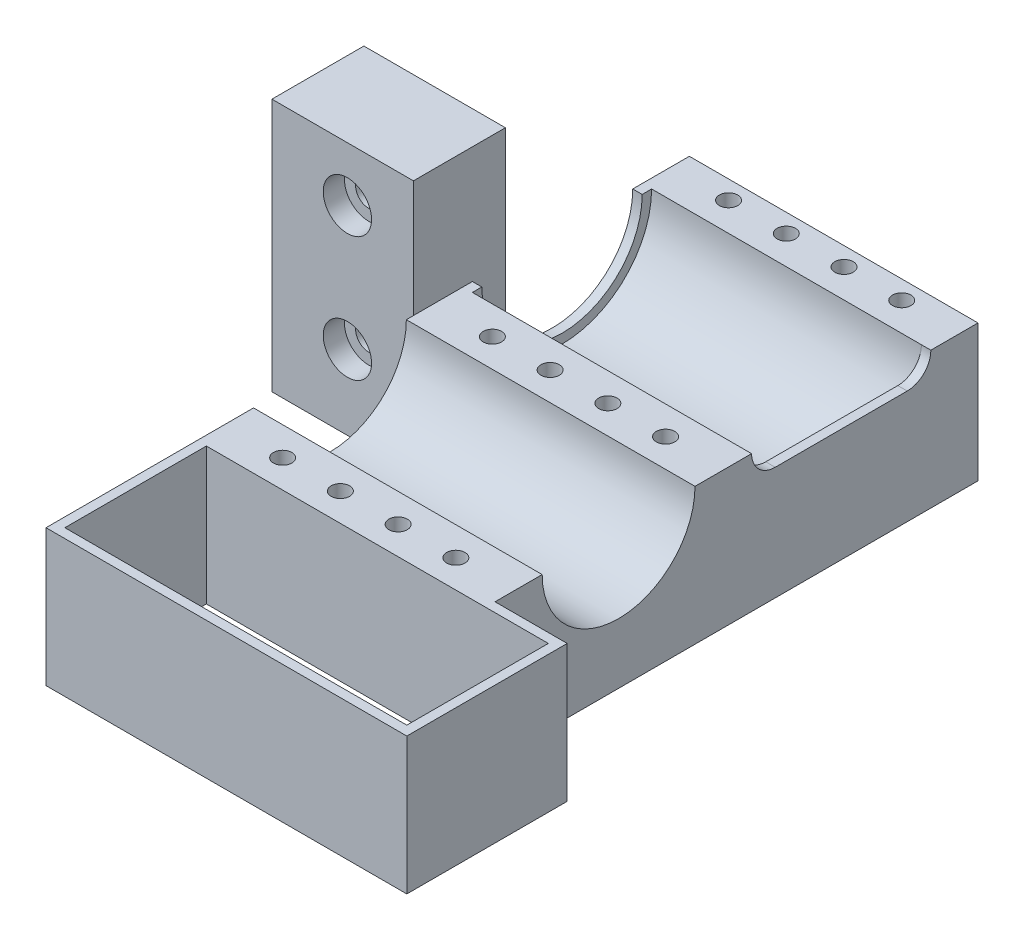
from build123d import *

# Parameters (mm, degrees)
BOSS_EXTRUDE1_DEPTH = 61.2
SKETCH7_W           = 19.50078266
SKETCH7_H           = 53.740928499
BOSS_EXTRUDE2_DEPTH = 30
BOSS_EXTRUDE3_START = -2
BOSS_EXTRUDE3_DEPTH = 2
BOSS_EXTRUDE4_DEPTH = 2
SKETCH26_W          = 76.5
SKETCH26_H          = 34
SKETCH26_W_2        = 72.5
SKETCH26_H_2        = 30
BOSS_EXTRUDE5_DEPTH = 29
SKETCH8_R           = 2.75
CUT_EXTRUDE1_DEPTH  = 19.50078266
SKETCH9_R           = 5.125
CUT_EXTRUDE2_DEPTH  = 4.5
CUT_EXTRUDE8_START  = -4.5
SKETCH10_R          = 5.125
CUT_EXTRUDE8_DEPTH  = 4.5
SKETCH22_R          = 1.95
CUT_EXTRUDE9_DEPTH  = 29
CUT_EXTRUDE10_DEPTH = 4.5
CUT_EXTRUE11_DEPTH  = 2


# Read off the part's stored shape, not the designer's step: Split1
with BuildPart() as part:
    # Sketch1 → Boss-Extrude1 (new body)
    with BuildSketch(Plane(origin=(0, 0, 0), x_dir=(0, 0, -1), z_dir=(1, 0, 0))):
        with BuildLine():
            Line((0, 0), (102.4, 0))
            Line((102.4, 0), (102.4, 29))
            Line((102.4, 29), (92.4, 29))
            ThreePointArc((92.4, 29), (73.4, 10), (54.4, 29))
            Line((54.4, 29), (42.4, 29))
            ThreePointArc((42.4, 29), (26.2, 12.8), (10, 29))
            Line((10, 29), (0, 29))
            Line((0, 29), (0, 0))
        make_face()
    extrude(amount=BOSS_EXTRUDE1_DEPTH)

    # Sketch7 → Boss-Extrude2 (add)
    with BuildSketch(Plane.ZY):
        with Locations((-53.64960867, 26.87046425)):
            Rectangle(SKETCH7_W, SKETCH7_H)
    extrude(amount=BOSS_EXTRUDE2_DEPTH)

    # Sketch14 → Boss-Extrude3 (add)
    with BuildSketch(Plane(origin=(61.2, 0, 0), x_dir=(0, 0, -1), z_dir=(1, 0, 0)).offset(BOSS_EXTRUDE3_START)):
        with BuildLine():
            Line((54.4, 29), (92.4, 29))
            ThreePointArc((92.4, 29), (73.4, 10), (54.4, 29))
        make_face()
    extrude(amount=BOSS_EXTRUDE3_DEPTH)

    # Sketch19 → Boss-Extrude4 (add)
    with BuildSketch(Plane.ZY):
        with BuildLine():
            Line((-90.4, 29), (-92.4, 29))
            ThreePointArc((-92.4, 29), (-82.646621004, 12.401807327), (-63.4, 12.844505579))
            ThreePointArc((-63.4, 12.844505579), (-56.801807327, 19.753378996), (-54.4, 29))
            Line((-54.4, 29), (-56.4, 29))
            ThreePointArc((-56.4, 29), (-58.548985503, 20.726707522), (-64.452631579, 14.545083939))
            ThreePointArc((-64.452631579, 14.545083939), (-81.673292478, 14.148985503), (-90.4, 29))
        make_face()
    extrude(amount=-BOSS_EXTRUDE4_DEPTH)

    # Sketch26 → Boss-Extrude5 (add)
    with BuildSketch(Plane(origin=(0, 0, 0), x_dir=(1, 0, 0), z_dir=(0, 1, 0))):
        with Locations((38.25, -17)):
            Rectangle(SKETCH26_W, SKETCH26_H)
        with Locations((38.25, -17)):
            Rectangle(SKETCH26_W_2, SKETCH26_H_2, mode=Mode.SUBTRACT)
    extrude(amount=BOSS_EXTRUDE5_DEPTH)

    # Sketch8 → Cut-Extrude1 (cut)
    with BuildSketch(Plane(origin=(0, 0, -63.4), x_dir=(-1, 0, 0), z_dir=(0, 0, -1))):
        with Locations((14, 42.2)):
            Circle(SKETCH8_R)
        with Locations((14, 15.8)):
            Circle(SKETCH8_R)
    extrude(amount=-CUT_EXTRUDE1_DEPTH, mode=Mode.SUBTRACT)

    # Sketch9 → Cut-Extrude2 (cut)
    with BuildSketch(Plane(origin=(0, 0, -63.4), x_dir=(-1, 0, 0), z_dir=(0, 0, -1))):
        with Locations((14, 42.2)):
            Circle(SKETCH9_R)
        with Locations((14, 15.8)):
            Circle(SKETCH9_R)
    extrude(amount=-CUT_EXTRUDE2_DEPTH, mode=Mode.SUBTRACT)

    # Sketch10 → Cut-Extrude8 (cut)
    with BuildSketch(Plane.XY.offset(-43.89921734).offset(CUT_EXTRUDE8_START)):
        with Locations(Location((-14, 42.2, 0), (0, 0, 180))):
            Circle(SKETCH10_R)
        with Locations(Location((-14, 15.8, 0), (0, 0, 180))):
            Circle(SKETCH10_R)
    extrude(amount=CUT_EXTRUDE8_DEPTH, mode=Mode.SUBTRACT)

    # Sketch22 → Cut-Extrude9 (cut)
    with BuildSketch(Plane(origin=(0, 29, 0), x_dir=(1, 0, 0), z_dir=(0, 1, 0))):
        with Locations(Location((12.24, 48.4, 0), (0, 0, 270))):
            Circle(SKETCH22_R)
        with Locations(Location((24.48, 48.4, 0), (0, 0, 270))):
            Circle(SKETCH22_R)
        with Locations(Location((36.72, 48.4, 0), (0, 0, 270))):
            Circle(SKETCH22_R)
        with Locations(Location((48.96, 48.4, 0), (0, 0, 270))):
            Circle(SKETCH22_R)
        with Locations(Location((48.96, 98.47, 0), (0, 0, 270))):
            Circle(SKETCH22_R)
        with Locations(Location((24.48, 98.47, 0), (0, 0, 270))):
            Circle(SKETCH22_R)
        with Locations(Location((12.24, 98.47, 0), (0, 0, 270))):
            Circle(SKETCH22_R)
        with Locations(Location((36.72, 3.93, 0), (0, 0, 270))):
            Circle(SKETCH22_R)
        with Locations(Location((48.96, 3.93, 0), (0, 0, 270))):
            Circle(SKETCH22_R)
        with Locations(Location((12.24, 3.93, 0), (0, 0, 270))):
            Circle(SKETCH22_R)
        with Locations(Location((36.72, 98.47, 0), (0, 0, 270))):
            Circle(SKETCH22_R)
        with Locations(Location((24.48, 3.93, 0), (0, 0, 270))):
            Circle(SKETCH22_R)
    extrude(amount=-CUT_EXTRUDE9_DEPTH, mode=Mode.SUBTRACT)

    # Sketch24 → Cut-Extrude10 (cut)
    with BuildSketch(Plane.XZ):
        Polygon((15.704101615, -3.93), (13.972050808, -0.93), (10.507949192, -0.93), (8.775898385, -3.93), (10.507949192, -6.93), (13.972050808, -6.93), align=None)
        Polygon((27.944101615, -3.93), (26.212050808, -0.93), (22.747949192, -0.93), (21.015898385, -3.93), (22.747949192, -6.93), (26.212050808, -6.93), align=None)
        Polygon((40.184101615, -3.93), (38.452050808, -0.93), (34.987949192, -0.93), (33.255898385, -3.93), (34.987949192, -6.93), (38.452050808, -6.93), align=None)
        Polygon((52.424101615, -3.93), (50.692050808, -0.93), (47.227949192, -0.93), (45.495898385, -3.93), (47.227949192, -6.93), (50.692050808, -6.93), align=None)
        Polygon((45.495898507, -48.400921437), (47.228747241, -51.400460612), (50.692848734, -51.399539176), (52.424101493, -48.399078563), (50.691252759, -45.399539388), (47.227151266, -45.400460824), align=None)
        Polygon((33.255898447, -48.400654162), (34.988515744, -51.400327028), (38.452617298, -51.399672865), (40.184101553, -48.399345838), (38.451484256, -45.399672972), (34.987382702, -45.400327135), align=None)
        Polygon((21.015898427, -48.400539686), (22.748416595, -51.400269807), (26.212518168, -51.399730121), (27.944101573, -48.399460314), (26.211583405, -45.399730193), (22.747481832, -45.400269879), align=None)
        Polygon((8.775898415, -48.400459038), (10.508346746, -51.400229493), (13.972448331, -51.399770455), (15.704101585, -48.399540962), (13.971653254, -45.399770507), (10.507551669, -45.400229545), align=None)
        Polygon((10.507949192, -95.47), (8.775898385, -98.47), (10.507949192, -101.47), (13.972050808, -101.47), (15.704101615, -98.47), (13.972050808, -95.47), align=None)
        Polygon((22.747949192, -95.47), (21.015898385, -98.47), (22.747949192, -101.47), (26.212050808, -101.47), (27.944101615, -98.47), (26.212050808, -95.47), align=None)
        Polygon((34.987949192, -95.47), (33.255898385, -98.47), (34.987949192, -101.47), (38.452050808, -101.47), (40.184101615, -98.47), (38.452050808, -95.47), align=None)
        Polygon((47.227949192, -95.47), (45.495898385, -98.47), (47.227949192, -101.47), (50.692050808, -101.47), (52.424101615, -98.47), (50.692050808, -95.47), align=None)
    extrude(amount=-CUT_EXTRUDE10_DEPTH, mode=Mode.SUBTRACT)

    # Sketch25 → Cut-Extrue11 (cut)
    with BuildSketch(Plane(origin=(61.2, 0, 0), x_dir=(0, 0, -1), z_dir=(1, 0, 0))):
        with BuildLine():
            Line((59.4, 34), (87.4, 34))
            ThreePointArc((87.4, 34), (92.4, 29), (87.4, 24))
            Line((87.4, 24), (59.4, 24))
            ThreePointArc((59.4, 24), (54.4, 29), (59.4, 34))
        make_face()
    extrude(amount=-CUT_EXTRUE11_DEPTH, mode=Mode.SUBTRACT)


with BuildPart() as body_2:
    # Split1: the piece on the far side of the plane
    add(part.part)
    split(bisect_by=Plane.YZ, keep=Keep.BOTTOM)


with BuildPart() as part_1:
    add(part.part)

    # Split1
    split(bisect_by=Plane.YZ, keep=Keep.TOP)


solid = Compound([body_2.part, part_1.part])
